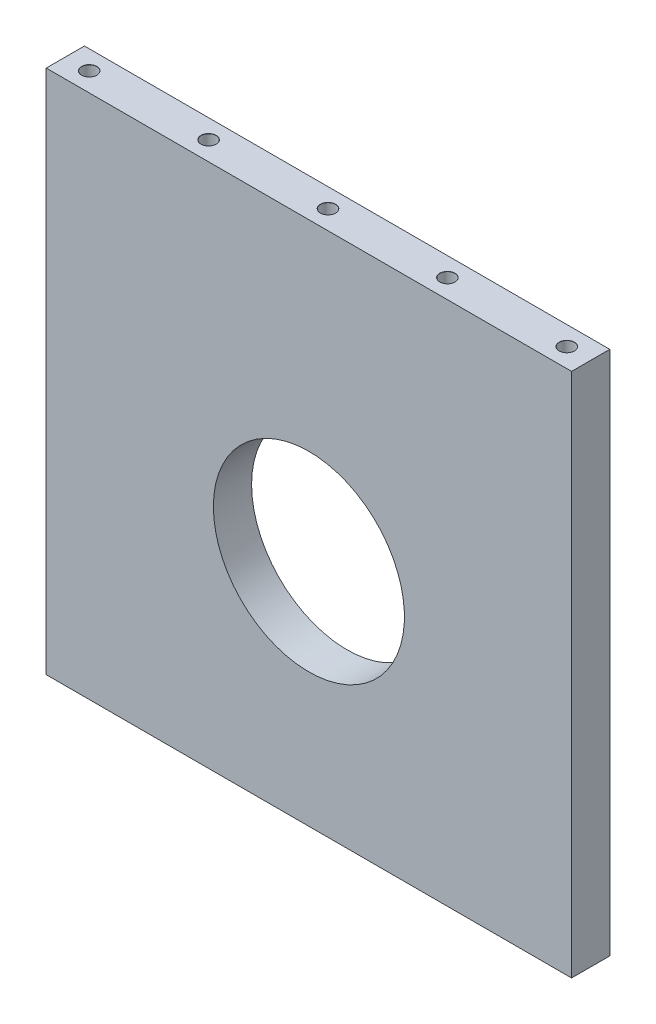
from build123d import *

# Parameters (mm, degrees)
SKETCH1_W                              = 110
SKETCH1_H                              = 110
BOSS_EXTRUDE1_DEPTH                    = 8
TAP_DRILL_FOR_M3_HELICOIL1_D           = 3.15
TAP_DRILL_FOR_M3_HELICOIL1_DEPTH       = 6
TAP_DRILL_FOR_M3_HELICOIL1_CSINK_D     = 3.2
TAP_DRILL_FOR_M3_HELICOIL1_CSINK_ANGLE = 90
TAP_DRILL_FOR_M3_HELICOIL1_TIP         = 0.946355475
F_40_0_40_DIAMETER_HOLE1_D             = 40


with BuildPart() as part:
    # Sketch1 → Boss-Extrude1 (new body)
    with BuildSketch(Plane.XY):
        with Locations((55, 55)):
            Rectangle(SKETCH1_W, SKETCH1_H)
    extrude(amount=BOSS_EXTRUDE1_DEPTH)

    # Tap Drill for M3 Helicoil1
    with Locations(Plane(origin=(0, 110, 0), x_dir=(1, 0, 0), z_dir=(0, 1, 0))):
        with Locations((5, -4), (55, -4), (80, -4), (105, -4), (30, -4)):
            CounterSinkHole(TAP_DRILL_FOR_M3_HELICOIL1_D / 2, TAP_DRILL_FOR_M3_HELICOIL1_CSINK_D / 2, depth=TAP_DRILL_FOR_M3_HELICOIL1_DEPTH, counter_sink_angle=TAP_DRILL_FOR_M3_HELICOIL1_CSINK_ANGLE)
            with Locations((0, 0, -(TAP_DRILL_FOR_M3_HELICOIL1_DEPTH + TAP_DRILL_FOR_M3_HELICOIL1_TIP / 2))):  # 118° drill point
                Cone(0, TAP_DRILL_FOR_M3_HELICOIL1_D / 2, TAP_DRILL_FOR_M3_HELICOIL1_TIP, mode=Mode.SUBTRACT)

    # Ø40.0 (40) Diameter Hole1 (through all)
    with Locations(Plane(origin=(0, 0, 0), x_dir=(-1, 0, 0), z_dir=(0, 0, -1))):
        with Locations((-55, 48)):
            Hole(F_40_0_40_DIAMETER_HOLE1_D / 2)


solid = part.part
